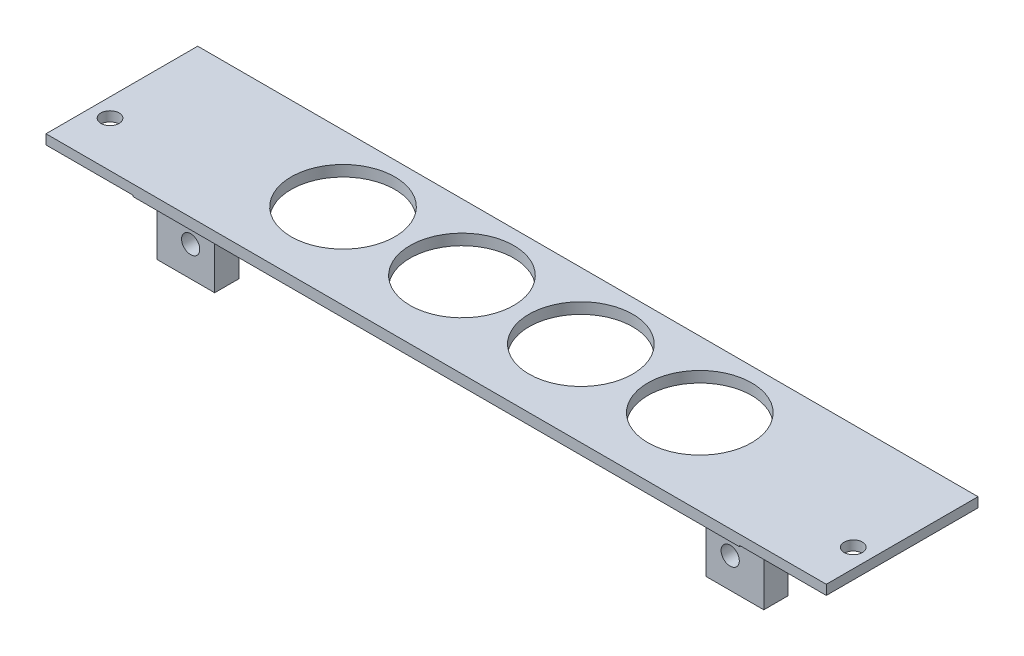
from build123d import *

# Parameters (mm, degrees)
SKETCH1_W           = 128.6
SKETCH1_H           = 25
SKETCH1_R           = 1.5
SKETCH1_R_2         = 8.55
BOSS_EXTRUDE1_DEPTH = 1.6
BOSS_EXTRUDE4_START = -0.2
SKETCH3_W           = 100
SKETCH3_H           = 25
SKETCH3_R           = 8.55
BOSS_EXTRUDE4_DEPTH = 0.2
SKETCH4_W           = 9.5
SKETCH4_H           = 11
SKETCH4_R           = 1.5
BOSS_EXTRUDE5_DEPTH = 4
FILLET1_R           = 2


with BuildPart() as part:
    # Sketch1 → Boss-Extrude1 (new body)
    with BuildSketch(Plane(origin=(0, 0, 0), x_dir=(1, 0, 0), z_dir=(0, 1, 0))):
        Rectangle(SKETCH1_W, SKETCH1_H)
        with Locations((-61.25, -5)):
            Circle(SKETCH1_R, mode=Mode.SUBTRACT)
        with Locations((61.25, -5)):
            Circle(SKETCH1_R, mode=Mode.SUBTRACT)
        with Locations((-29.4, 1.55)):
            Circle(SKETCH1_R_2, mode=Mode.SUBTRACT)
        with Locations((-9.8, 1.55)):
            Circle(SKETCH1_R_2, mode=Mode.SUBTRACT)
        with Locations((9.8, 1.55)):
            Circle(SKETCH1_R_2, mode=Mode.SUBTRACT)
        with Locations((29.4, 1.55)):
            Circle(SKETCH1_R_2, mode=Mode.SUBTRACT)
    extrude(amount=BOSS_EXTRUDE1_DEPTH)

    # Sketch3 → Boss-Extrude4 (add)
    with BuildSketch(Plane(origin=(0, 0, 0), x_dir=(1, 0, 0), z_dir=(0, 1, 0)).offset(BOSS_EXTRUDE4_START)):
        Rectangle(SKETCH3_W, SKETCH3_H)
        with Locations((-29.4, 1.55)):
            Circle(SKETCH3_R, mode=Mode.SUBTRACT)
        with Locations((-9.8, 1.55)):
            Circle(SKETCH3_R, mode=Mode.SUBTRACT)
        with Locations((9.8, 1.55)):
            Circle(SKETCH3_R, mode=Mode.SUBTRACT)
        with Locations((29.4, 1.55)):
            Circle(SKETCH3_R, mode=Mode.SUBTRACT)
    extrude(amount=BOSS_EXTRUDE4_DEPTH)

    # Sketch4 → Boss-Extrude5 (add)
    # profile 1 of 2: a face of its own
    with BuildSketch(Plane.XY.offset(8.5)):
        with Locations((-45.25, -5.7)):
            Rectangle(SKETCH4_W, SKETCH4_H)
        with Locations((-44.46, -6.24)):
            Circle(SKETCH4_R, mode=Mode.SUBTRACT)
    # profile 2 of 2: a face of its own
    with BuildSketch(Plane.XY.offset(8.5)):
        with Locations((45.25, -5.7)):
            Rectangle(SKETCH4_W, SKETCH4_H)
        with Locations((44.46, -6.24)):
            Circle(SKETCH4_R, mode=Mode.SUBTRACT)
    extrude(amount=-BOSS_EXTRUDE5_DEPTH)

    # Fillet1
    fillet1_edges = [part.edges().sort_by_distance(p)[0] for p in [
        (-45.25, -0.2, 4.5),
        (45.25, -0.2, 4.5),
    ]]
    fillet(fillet1_edges, radius=FILLET1_R)


solid = part.part
